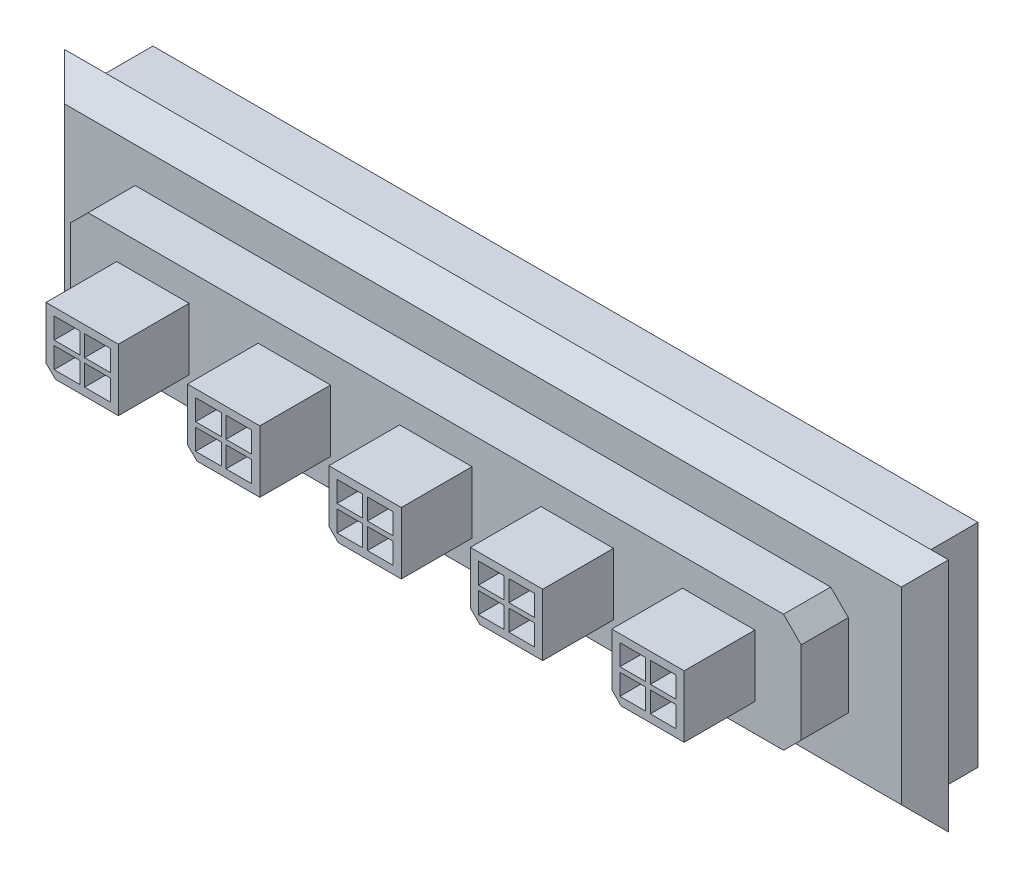
from build123d import *

# Parameters (mm, degrees)
SKETCH1_W            = 75
SKETCH1_H            = 20
BOSS_EXTRUDE1_DEPTH  = 2
SKETCH2_W            = 62
SKETCH2_H            = 10
BOSS_EXTRUDE2_DEPTH  = 4
SKETCH3_W            = 70
SKETCH3_H            = 18
BOSS_EXTRUDE3_DEPTH  = 5
SKETCH4_W            = 6.142437882
SKETCH4_H            = 5.25340082
BOSS_EXTRUDE4_DEPTH  = 6
SKETCH6_W            = 2.181176029
SKETCH6_H            = 1.77174688
CUT_EXTRUDE1_DEPTH   = 6
LPATTERN1_COUNT      = 3
LPATTERN1_PITCH      = 12
LPATTERN1_COUNT_DIR2 = 3
LPATTERN1_PITCH_DIR2 = 12
CHAMFER1_SIZE        = 0.8
CHAMFER2_SIZE        = 1.5
CHAMFER4_SIZE        = 2


with BuildPart() as part:
    # Sketch1 → Boss-Extrude1 (new body)
    with BuildSketch(Plane.XY):
        Rectangle(SKETCH1_W, SKETCH1_H)
    extrude(amount=BOSS_EXTRUDE1_DEPTH)

    # Sketch2 → Boss-Extrude2 (add)
    with BuildSketch(Plane.XY.offset(2)):
        Rectangle(SKETCH2_W, SKETCH2_H)
    extrude(amount=BOSS_EXTRUDE2_DEPTH)

    # Sketch3 → Boss-Extrude3 (add)
    with BuildSketch(Plane(origin=(0, 0, 0), x_dir=(-1, 0, 0), z_dir=(0, 0, -1))):
        Rectangle(SKETCH3_W, SKETCH3_H)
    extrude(amount=BOSS_EXTRUDE3_DEPTH)

    # Sketch4 → Boss-Extrude4 (add)
    with BuildSketch(Plane.XY.offset(6)):
        Rectangle(SKETCH4_W, SKETCH4_H)
    boss_extrude4 = extrude(amount=BOSS_EXTRUDE4_DEPTH)

    # Sketch6 → Cut-Extrude1 (cut)
    with BuildSketch(Plane.XY.offset(12)):
        with Locations((1.290588015, 1.08587344)):
            Rectangle(SKETCH6_W, SKETCH6_H)
        with Locations((-1.290588015, 1.08587344)):
            Rectangle(SKETCH6_W, SKETCH6_H)
        with Locations((-1.290588015, -1.08587344)):
            Rectangle(SKETCH6_W, SKETCH6_H)
        with Locations((1.290588015, -1.08587344)):
            Rectangle(SKETCH6_W, SKETCH6_H)
    cut_extrude1 = extrude(amount=-CUT_EXTRUDE1_DEPTH, mode=Mode.SUBTRACT)

    # LPattern1: Boss-Extrude4, Cut-Extrude1 3 × 3
    with Locations(*[Vector(1, 0, 0) * (i * LPATTERN1_PITCH) + Vector(-1, 0, 0) * (j * LPATTERN1_PITCH_DIR2) for i in range(LPATTERN1_COUNT) for j in range(LPATTERN1_COUNT_DIR2) if (i, j) != (0, 0)]):
        add(boss_extrude4)
        add(cut_extrude1, mode=Mode.SUBTRACT)

    # Chamfer1
    chamfer1_edges = [part.edges().sort_by_distance(p)[0] for p in [
        (-15.071218941, -2.62670041, 9),
        (-27.071218941, -2.62670041, 9),
        (8.928781059, -2.62670041, 9),
        (20.928781059, -2.62670041, 9),
        (-3.071218941, -2.62670041, 9),
    ]]
    chamfer(chamfer1_edges, length=CHAMFER1_SIZE)

    # Chamfer2
    chamfer2_edges = [part.edges().sort_by_distance(p)[0] for p in [
        (31, -5, 4),
        (31, 5, 4),
        (-31, 5, 4),
        (-31, -5, 4),
    ]]
    chamfer(chamfer2_edges, length=CHAMFER2_SIZE)

    # Chamfer4
    chamfer4_edges = [part.edges().sort_by_distance(p)[0] for p in [
        (0, 10, 2),
        (37.5, 0, 2),
        (0, -10, 2),
        (-37.5, 0, 2),
    ]]
    chamfer(chamfer4_edges, length=CHAMFER4_SIZE - 0.0001)  # a hair under: the kernel refuses the full size


solid = part.part
